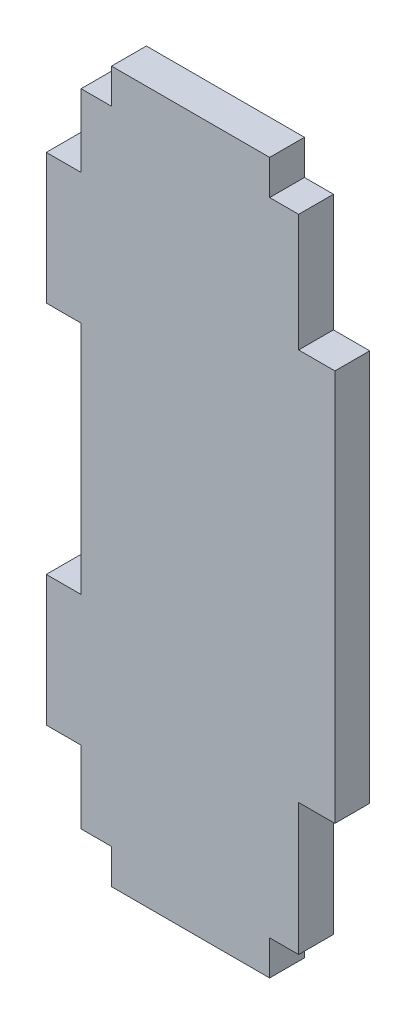
from build123d import *

# Parameters (mm, degrees)
BOSS_EXTRUDE1_DEPTH = 3.048


with BuildPart() as part:
    # Sketch1 → Boss-Extrude1 (new body)
    with BuildSketch(Plane.XY):
        Polygon((0, -13.335), (-3.175, -13.335), (-3.175, -3.048), (-5.715, -3.048), (-5.715, 0), (-19.558, 0), (-19.558, -3.048), (-22.225, -3.048), (-22.225, -9.398), (-25.273, -9.398), (-25.273, -20.828), (-22.225, -20.828), (-22.225, -41.402), (-25.273, -41.402), (-25.273, -52.832), (-22.225, -52.832), (-22.225, -59.182), (-19.558, -59.182), (-19.558, -62.23), (-5.715, -62.23), (-5.715, -59.182), (-3.175, -59.182), (-3.175, -47.6504), (0, -47.6504), align=None)
    extrude(amount=BOSS_EXTRUDE1_DEPTH)


solid = part.part
